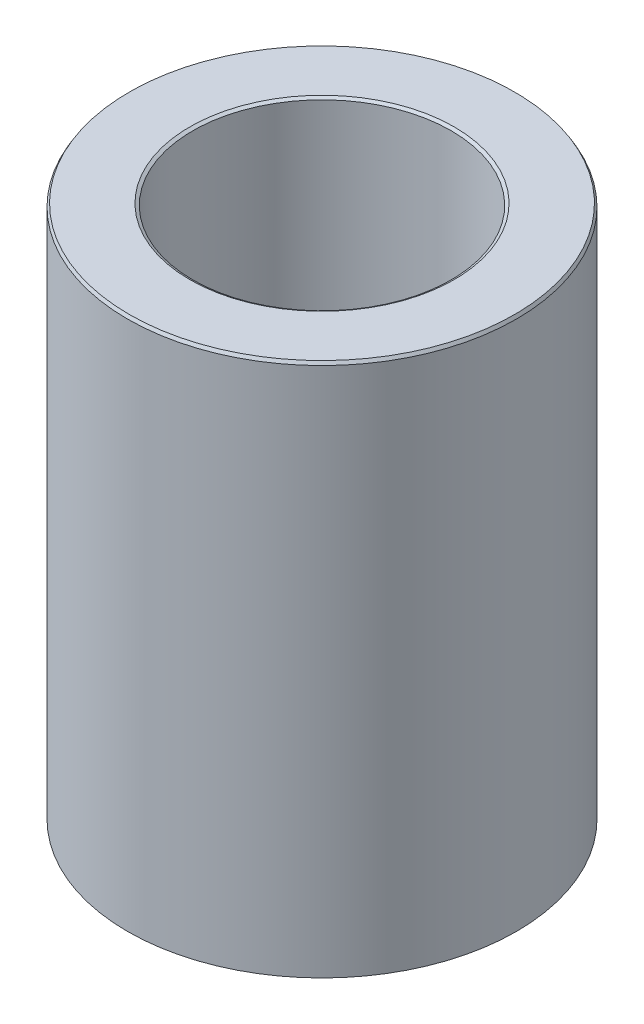
from build123d import *
from OCP.BRepFilletAPI import BRepFilletAPI_MakeChamfer

# Parameters (mm, degrees)
SKETCH1_R           = 57.5
BOSS_EXTRUDE1_DEPTH = 158.263329587
SKETCH2_R           = 38.206905958
CUT_EXTRUDE1_DEPTH  = 178.931957478
CHAMFER1_SIZE       = 0.907701299
CHAMFER1_SIZE2      = 0.524061589


with BuildPart() as part:
    # Sketch1 → Boss-Extrude1 (new body)
    with BuildSketch(Plane(origin=(0, 0, 0), x_dir=(1, 0, 0), z_dir=(0, 1, 0))):
        Circle(SKETCH1_R)
    extrude(amount=BOSS_EXTRUDE1_DEPTH)

    # Sketch2 → Cut-Extrude1 (cut, through all)
    with BuildSketch(Plane(origin=(0, 0, 0), x_dir=(1, 0, 0), z_dir=(0, 1, 0))):
        Circle(SKETCH2_R)
    extrude(amount=CUT_EXTRUDE1_DEPTH, mode=Mode.SUBTRACT)

    # Chamfer1: one chamfer whose edges measure the first distance from different faces: ONE call of the kernel's chamfer builder (chamfer() names one face for all edges)
    chamfer1_edges_1 = [part.edges().sort_by_distance(p)[0] for p in [
        (-38.206905958, 158.263329587, 0),
    ]]
    chamfer1_side_1 = [part.faces().sort_by_distance(p)[0] for p in [
        (-55.873654403, 158.263329587, 0),
    ]]
    chamfer1_edges_2 = [part.edges().sort_by_distance(p)[0] for p in [
        (-38.206905958, 0, 0),
    ]]
    chamfer1_side_2 = [part.faces().sort_by_distance(p)[0] for p in [
        (-38.206905958, 79.131664793, 0),
    ]]
    chamfer1_edges_3 = [part.edges().sort_by_distance(p)[0] for p in [
        (-57.5, 0, 0),
    ]]
    chamfer1_side_3 = [part.faces().sort_by_distance(p)[0] for p in [
        (-55.873654403, 0, 0),
    ]]
    chamfer1_edges_4 = [part.edges().sort_by_distance(p)[0] for p in [
        (-57.5, 158.263329587, 0),
    ]]
    chamfer1_side_4 = [part.faces().sort_by_distance(p)[0] for p in [
        (-57.5, 79.131664793, 0),
    ]]
    chamfer1 = BRepFilletAPI_MakeChamfer(part.part.solid().wrapped)
    for e in chamfer1_edges_1:
        chamfer1.Add(CHAMFER1_SIZE, CHAMFER1_SIZE2, e.wrapped, chamfer1_side_1[0].wrapped)  # the first distance lies on this face
    for e in chamfer1_edges_2:
        chamfer1.Add(CHAMFER1_SIZE, CHAMFER1_SIZE2, e.wrapped, chamfer1_side_2[0].wrapped)  # the first distance lies on this face
    for e in chamfer1_edges_3:
        chamfer1.Add(CHAMFER1_SIZE, CHAMFER1_SIZE2, e.wrapped, chamfer1_side_3[0].wrapped)  # the first distance lies on this face
    for e in chamfer1_edges_4:
        chamfer1.Add(CHAMFER1_SIZE, CHAMFER1_SIZE2, e.wrapped, chamfer1_side_4[0].wrapped)  # the first distance lies on this face
    add(Compound.cast(chamfer1.Shape()), mode=Mode.REPLACE)


solid = part.part
